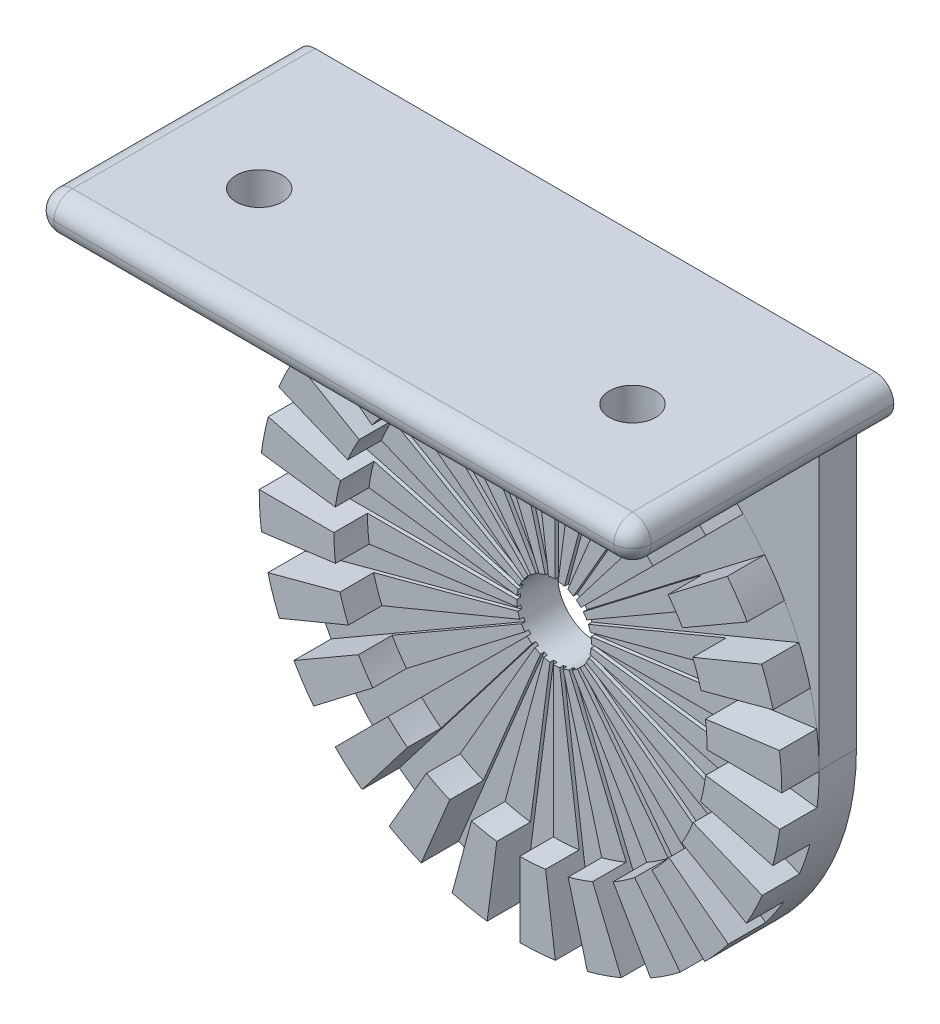
from build123d import *

# Parameters (mm, degrees)
BOSS_EXTRUDE2_DEPTH     = 5
BOSS_EXTRUDE2_2_DEPTH   = 5
BOSS_EXTRUDE2_3_DEPTH   = 5
BOSS_EXTRUDE2_4_DEPTH   = 5
BOSS_EXTRUDE2_5_DEPTH   = 5
BOSS_EXTRUDE2_6_DEPTH   = 5
BOSS_EXTRUDE2_7_DEPTH   = 5
BOSS_EXTRUDE2_8_DEPTH   = 5
BOSS_EXTRUDE2_9_DEPTH   = 5
BOSS_EXTRUDE2_10_DEPTH  = 5
BOSS_EXTRUDE2_11_DEPTH  = 5
BOSS_EXTRUDE2_12_DEPTH  = 5
BOSS_EXTRUDE2_13_DEPTH  = 5
BOSS_EXTRUDE2_14_DEPTH  = 5
BOSS_EXTRUDE2_15_DEPTH  = 5
BOSS_EXTRUDE2_16_DEPTH  = 5
BOSS_EXTRUDE2_17_DEPTH  = 5
BOSS_EXTRUDE2_18_DEPTH  = 5
BOSS_EXTRUDE2_19_DEPTH  = 5
BOSS_EXTRUDE2_20_DEPTH  = 5
BOSS_EXTRUDE2_21_DEPTH  = 5
BOSS_EXTRUDE2_22_DEPTH  = 5
BOSS_EXTRUDE2_23_DEPTH  = 5
BOSS_EXTRUDE2_24_DEPTH  = 5
BOSS_EXTRUDE3_DEPTH     = 10
CUT_EXTRUDE1_DEPTH      = 51.497524692
CUT_EXTRUDE1_DEPTH_BACK = 51.497524692
SKETCH3_R               = 5
CUT_EXTRUDE6_START      = 5.5
SKETCH9_R               = 25
CUT_EXTRUDE6_DEPTH      = 5.5
SKETCH4_W               = 80
SKETCH4_H               = 35
BOSS_EXTRUDE4_DEPTH     = 5
SKETCH6_R               = 3.1
CUT_EXTRUDE2_DEPTH      = 97.046863562
BOSS_EXTRUDE5_DEPTH     = 5
FILLET2_R               = 2.5


# Read off the part's stored shape, not the designer's step: Boss-Extrude3
with BuildPart() as part:
    # Sketch1 → Boss-Extrude2 (new body)
    with BuildSketch(Plane.XY):
        with BuildLine():
            Line((-34.999857143, 0.1), (-1.525705169, 0.1))
            Line((-1.525705169, 0.1), (-34.713481132, 4.469253595))
            ThreePointArc((-34.713481132, 4.469253595), (-34.925062313, 2.289109523), (-34.999857143, 0.1))
        make_face()
    extrude(amount=BOSS_EXTRUDE2_DEPTH)



with BuildPart() as body_2:
    # Sketch1 → Boss-Extrude2 2 (new body)
    with BuildSketch(Plane.XY):
        with BuildLine():
            ThreePointArc((-32.373919998, 13.30147751), (-33.142554532, 11.250381286), (-33.781384026, 9.155222187))
            Line((-33.781384026, 9.155222187), (-1.447836121, 0.491474138))
            Line((-1.447836121, 0.491474138), (-32.373919998, 13.30147751))
        make_face()
    extrude(amount=BOSS_EXTRUDE2_2_DEPTH)


with BuildPart() as body_3:
    # Sketch1 → Boss-Extrude2 3 (new body)
    with BuildSketch(Plane.XY):
        with BuildLine():
            ThreePointArc((-27.828129717, 21.227227715), (-29.101436431, 19.444958156), (-30.260765414, 17.586531112))
            Line((-30.260765414, 17.586531112), (-1.271299435, 0.849455125))
            Line((-1.271299435, 0.849455125), (-27.828129717, 21.227227715))
        make_face()
    extrude(amount=BOSS_EXTRUDE2_3_DEPTH)


with BuildPart() as body_4:
    # Sketch1 → Boss-Extrude2 4 (new body)
    with BuildSketch(Plane.XY):
        with BuildLine():
            ThreePointArc((-21.385898383, 27.706377431), (-23.077103529, 26.314393262), (-24.677925648, 24.819347004))
            Line((-24.677925648, 24.819347004), (-1.008125793, 1.149547149))
            Line((-1.008125793, 1.149547149), (-21.385898383, 27.706377431))
        make_face()
    extrude(amount=BOSS_EXTRUDE2_4_DEPTH)


with BuildPart() as body_5:
    # Sketch1 → Boss-Extrude2 5 (new body)
    with BuildSketch(Plane.XY):
        with BuildLine():
            ThreePointArc((-13.486253417, 32.297383312), (-15.480104158, 31.390545954), (-17.413326031, 30.360765414))
            Line((-17.413326031, 30.360765414), (-0.676250044, 1.371299435))
            Line((-0.676250044, 1.371299435), (-13.486253417, 32.297383312))
        make_face()
    extrude(amount=BOSS_EXTRUDE2_5_DEPTH)


with BuildPart() as body_6:
    # Sketch1 → Boss-Extrude2 6 (new body)
    with BuildSketch(Plane.XY):
        with BuildLine():
            ThreePointArc((-4.667542567, 34.687375894), (-6.828161271, 34.327484814), (-8.962037022, 33.833147835))
            Line((-8.962037022, 33.833147835), (-0.298288972, 1.49959993))
            Line((-0.298288972, 1.49959993), (-4.667542567, 34.687375894))
        make_face()
    extrude(amount=BOSS_EXTRUDE2_6_DEPTH)


with BuildPart() as body_7:
    # Sketch1 → Boss-Extrude2 7 (new body)
    with BuildSketch(Plane.XY):
        with BuildLine():
            ThreePointArc((4.469253595, 34.713481132), (2.289109523, 34.925062313), (0.1, 34.999857143))
            Line((0.1, 34.999857143), (0.1, 1.525705169))
            Line((0.1, 1.525705169), (4.469253595, 34.713481132))
        make_face()
    extrude(amount=BOSS_EXTRUDE2_7_DEPTH)


with BuildPart() as body_8:
    # Sketch1 → Boss-Extrude2 8 (new body)
    with BuildSketch(Plane.XY):
        with BuildLine():
            ThreePointArc((13.30147751, 32.373919998), (11.250381286, 33.142554532), (9.155222187, 33.781384026))
            Line((9.155222187, 33.781384026), (0.491474138, 1.447836121))
            Line((0.491474138, 1.447836121), (13.30147751, 32.373919998))
        make_face()
    extrude(amount=BOSS_EXTRUDE2_8_DEPTH)


with BuildPart() as body_9:
    # Sketch1 → Boss-Extrude2 9 (new body)
    with BuildSketch(Plane.XY):
        with BuildLine():
            ThreePointArc((21.227227715, 27.828129717), (19.444958156, 29.101436431), (17.586531112, 30.260765414))
            Line((17.586531112, 30.260765414), (0.849455125, 1.271299435))
            Line((0.849455125, 1.271299435), (21.227227715, 27.828129717))
        make_face()
    extrude(amount=BOSS_EXTRUDE2_9_DEPTH)


with BuildPart() as body_10:
    # Sketch1 → Boss-Extrude2 10 (new body)
    with BuildSketch(Plane.XY):
        with BuildLine():
            ThreePointArc((27.706377431, 21.385898383), (26.314393262, 23.077103529), (24.819347004, 24.677925648))
            Line((24.819347004, 24.677925648), (1.149547149, 1.008125793))
            Line((1.149547149, 1.008125793), (27.706377431, 21.385898383))
        make_face()
    extrude(amount=BOSS_EXTRUDE2_10_DEPTH)


with BuildPart() as body_11:
    # Sketch1 → Boss-Extrude2 11 (new body)
    with BuildSketch(Plane.XY):
        with BuildLine():
            ThreePointArc((32.297383312, 13.486253417), (31.390545954, 15.480104158), (30.360765414, 17.413326031))
            Line((30.360765414, 17.413326031), (1.371299435, 0.676250044))
            Line((1.371299435, 0.676250044), (32.297383312, 13.486253417))
        make_face()
    extrude(amount=BOSS_EXTRUDE2_11_DEPTH)


with BuildPart() as body_12:
    # Sketch1 → Boss-Extrude2 12 (new body)
    with BuildSketch(Plane.XY):
        with BuildLine():
            ThreePointArc((34.687375894, 4.667542567), (34.327484814, 6.828161271), (33.833147835, 8.962037022))
            Line((33.833147835, 8.962037022), (1.49959993, 0.298288972))
            Line((1.49959993, 0.298288972), (34.687375894, 4.667542567))
        make_face()
    extrude(amount=BOSS_EXTRUDE2_12_DEPTH)


with BuildPart() as body_13:
    # Sketch1 → Boss-Extrude2 13 (new body)
    with BuildSketch(Plane.XY):
        with BuildLine():
            Line((1.525705169, -0.1), (34.713481132, -4.469253595))
            ThreePointArc((34.713481132, -4.469253595), (34.925062313, -2.289109523), (34.999857143, -0.1))
            Line((34.999857143, -0.1), (1.525705169, -0.1))
        make_face()
    extrude(amount=BOSS_EXTRUDE2_13_DEPTH)


with BuildPart() as body_14:
    # Sketch1 → Boss-Extrude2 14 (new body)
    with BuildSketch(Plane.XY):
        with BuildLine():
            Line((1.447836121, -0.491474138), (32.373919998, -13.30147751))
            ThreePointArc((32.373919998, -13.30147751), (33.142554532, -11.250381286), (33.781384026, -9.155222187))
            Line((33.781384026, -9.155222187), (1.447836121, -0.491474138))
        make_face()
    extrude(amount=BOSS_EXTRUDE2_14_DEPTH)


with BuildPart() as body_15:
    # Sketch1 → Boss-Extrude2 15 (new body)
    with BuildSketch(Plane.XY):
        with BuildLine():
            Line((1.271299435, -0.849455125), (27.828129717, -21.227227715))
            ThreePointArc((27.828129717, -21.227227715), (29.101436431, -19.444958156), (30.260765414, -17.586531112))
            Line((30.260765414, -17.586531112), (1.271299435, -0.849455125))
        make_face()
    extrude(amount=BOSS_EXTRUDE2_15_DEPTH)


with BuildPart() as body_16:
    # Sketch1 → Boss-Extrude2 16 (new body)
    with BuildSketch(Plane.XY):
        with BuildLine():
            Line((1.008125793, -1.149547149), (21.385898383, -27.706377431))
            ThreePointArc((21.385898383, -27.706377431), (23.077103529, -26.314393262), (24.677925648, -24.819347004))
            Line((24.677925648, -24.819347004), (1.008125793, -1.149547149))
        make_face()
    extrude(amount=BOSS_EXTRUDE2_16_DEPTH)


with BuildPart() as body_17:
    # Sketch1 → Boss-Extrude2 17 (new body)
    with BuildSketch(Plane.XY):
        with BuildLine():
            Line((0.676250044, -1.371299435), (13.486253417, -32.297383312))
            ThreePointArc((13.486253417, -32.297383312), (15.480104158, -31.390545954), (17.413326031, -30.360765414))
            Line((17.413326031, -30.360765414), (0.676250044, -1.371299435))
        make_face()
    extrude(amount=BOSS_EXTRUDE2_17_DEPTH)


with BuildPart() as body_18:
    # Sketch1 → Boss-Extrude2 18 (new body)
    with BuildSketch(Plane.XY):
        with BuildLine():
            Line((0.298288972, -1.49959993), (4.667542567, -34.687375894))
            ThreePointArc((4.667542567, -34.687375894), (6.828161271, -34.327484814), (8.962037022, -33.833147835))
            Line((8.962037022, -33.833147835), (0.298288972, -1.49959993))
        make_face()
    extrude(amount=BOSS_EXTRUDE2_18_DEPTH)


with BuildPart() as body_19:
    # Sketch1 → Boss-Extrude2 19 (new body)
    with BuildSketch(Plane.XY):
        with BuildLine():
            Line((-0.1, -1.525705169), (-4.469253595, -34.713481132))
            ThreePointArc((-4.469253595, -34.713481132), (-2.289109523, -34.925062313), (-0.1, -34.999857143))
            Line((-0.1, -34.999857143), (-0.1, -1.525705169))
        make_face()
    extrude(amount=BOSS_EXTRUDE2_19_DEPTH)


with BuildPart() as body_20:
    # Sketch1 → Boss-Extrude2 20 (new body)
    with BuildSketch(Plane.XY):
        with BuildLine():
            Line((-0.491474138, -1.447836121), (-13.30147751, -32.373919998))
            ThreePointArc((-13.30147751, -32.373919998), (-11.250381286, -33.142554532), (-9.155222187, -33.781384026))
            Line((-9.155222187, -33.781384026), (-0.491474138, -1.447836121))
        make_face()
    extrude(amount=BOSS_EXTRUDE2_20_DEPTH)


with BuildPart() as body_21:
    # Sketch1 → Boss-Extrude2 21 (new body)
    with BuildSketch(Plane.XY):
        with BuildLine():
            Line((-0.849455125, -1.271299435), (-21.227227715, -27.828129717))
            ThreePointArc((-21.227227715, -27.828129717), (-19.444958156, -29.101436431), (-17.586531112, -30.260765414))
            Line((-17.586531112, -30.260765414), (-0.849455125, -1.271299435))
        make_face()
    extrude(amount=BOSS_EXTRUDE2_21_DEPTH)


with BuildPart() as body_22:
    # Sketch1 → Boss-Extrude2 22 (new body)
    with BuildSketch(Plane.XY):
        with BuildLine():
            Line((-1.149547149, -1.008125793), (-27.706377431, -21.385898383))
            ThreePointArc((-27.706377431, -21.385898383), (-26.314393262, -23.077103529), (-24.819347004, -24.677925648))
            Line((-24.819347004, -24.677925648), (-1.149547149, -1.008125793))
        make_face()
    extrude(amount=BOSS_EXTRUDE2_22_DEPTH)


with BuildPart() as body_23:
    # Sketch1 → Boss-Extrude2 23 (new body)
    with BuildSketch(Plane.XY):
        with BuildLine():
            Line((-1.49959993, -0.298288972), (-34.687375894, -4.667542567))
            ThreePointArc((-34.687375894, -4.667542567), (-34.327484814, -6.828161271), (-33.833147835, -8.962037022))
            Line((-33.833147835, -8.962037022), (-1.49959993, -0.298288972))
        make_face()
    extrude(amount=BOSS_EXTRUDE2_23_DEPTH)


with BuildPart() as body_24:
    # Sketch1 → Boss-Extrude2 24 (new body)
    with BuildSketch(Plane.XY):
        with BuildLine():
            Line((-1.371299435, -0.676250044), (-32.297383312, -13.486253417))
            ThreePointArc((-32.297383312, -13.486253417), (-31.390545954, -15.480104158), (-30.360765414, -17.413326031))
            Line((-30.360765414, -17.413326031), (-1.371299435, -0.676250044))
        make_face()
    extrude(amount=BOSS_EXTRUDE2_24_DEPTH)


with BuildPart() as part_1:
    add(part.part)

    add(body_2.part)  # Boss-Extrude3 merges body 2

    add(body_3.part)  # Boss-Extrude3 merges body 3

    add(body_4.part)  # Boss-Extrude3 merges body 4

    add(body_5.part)  # Boss-Extrude3 merges body 5

    add(body_6.part)  # Boss-Extrude3 merges body 6

    add(body_7.part)  # Boss-Extrude3 merges body 7

    add(body_8.part)  # Boss-Extrude3 merges body 8

    add(body_9.part)  # Boss-Extrude3 merges body 9

    add(body_10.part)  # Boss-Extrude3 merges body 10

    add(body_11.part)  # Boss-Extrude3 merges body 11

    add(body_12.part)  # Boss-Extrude3 merges body 12

    add(body_13.part)  # Boss-Extrude3 merges body 13

    add(body_14.part)  # Boss-Extrude3 merges body 14

    add(body_15.part)  # Boss-Extrude3 merges body 15

    add(body_16.part)  # Boss-Extrude3 merges body 16

    add(body_17.part)  # Boss-Extrude3 merges body 17

    add(body_18.part)  # Boss-Extrude3 merges body 18

    add(body_19.part)  # Boss-Extrude3 merges body 19

    add(body_20.part)  # Boss-Extrude3 merges body 20

    add(body_21.part)  # Boss-Extrude3 merges body 21

    add(body_22.part)  # Boss-Extrude3 merges body 22

    add(body_23.part)  # Boss-Extrude3 merges body 23

    add(body_24.part)  # Boss-Extrude3 merges body 24
    # Boss-Extrude3 outline → Boss-Extrude3 (add)
    with BuildSketch(Plane.XY):
        with BuildLine():
            ThreePointArc((34.999857143, -0.1), (34.925062313, 2.289109523), (34.687375894, 4.667542567))
            Line((34.687375894, 4.667542567), (1.49959993, 0.298288972))
            Line((1.49959993, 0.298288972), (33.833147835, 8.962037022))
            ThreePointArc((33.833147835, 8.962037022), (33.142554532, 11.250381286), (32.297383312, 13.486253417))
            Line((32.297383312, 13.486253417), (1.371299435, 0.676250044))
            Line((1.371299435, 0.676250044), (30.360765414, 17.413326031))
            ThreePointArc((30.360765414, 17.413326031), (29.101436431, 19.444958156), (27.706377431, 21.385898383))
            Line((27.706377431, 21.385898383), (1.149547149, 1.008125793))
            Line((1.149547149, 1.008125793), (24.819347004, 24.677925648))
            ThreePointArc((24.819347004, 24.677925648), (23.077103528, 26.314393262), (21.227227715, 27.828129717))
            Line((21.227227715, 27.828129717), (0.849455125, 1.271299435))
            Line((0.849455125, 1.271299435), (17.586531112, 30.260765414))
            ThreePointArc((17.586531112, 30.260765414), (15.480104158, 31.390545954), (13.30147751, 32.373919998))
            Line((13.30147751, 32.373919998), (0.491474138, 1.447836121))
            Line((0.491474138, 1.447836121), (9.155222187, 33.781384026))
            ThreePointArc((9.155222187, 33.781384026), (6.828161271, 34.327484814), (4.469253595, 34.713481132))
            Line((4.469253595, 34.713481132), (0.1, 1.525705169))
            Line((0.1, 1.525705169), (0.1, 34.999857143))
            ThreePointArc((0.1, 34.999857143), (-2.289109523, 34.925062313), (-4.667542567, 34.687375894))
            Line((-4.667542567, 34.687375894), (-0.298288972, 1.49959993))
            Line((-0.298288972, 1.49959993), (-8.962037022, 33.833147835))
            ThreePointArc((-8.962037022, 33.833147835), (-11.250381286, 33.142554532), (-13.486253417, 32.297383312))
            Line((-13.486253417, 32.297383312), (-0.676250044, 1.371299435))
            Line((-0.676250044, 1.371299435), (-17.413326031, 30.360765414))
            ThreePointArc((-17.413326031, 30.360765414), (-19.444958156, 29.101436431), (-21.385898383, 27.706377431))
            Line((-21.385898383, 27.706377431), (-1.008125793, 1.149547149))
            Line((-1.008125793, 1.149547149), (-24.677925648, 24.819347004))
            ThreePointArc((-24.677925648, 24.819347004), (-26.314393262, 23.077103528), (-27.828129717, 21.227227715))
            Line((-27.828129717, 21.227227715), (-1.271299435, 0.849455125))
            Line((-1.271299435, 0.849455125), (-30.260765414, 17.586531112))
            ThreePointArc((-30.260765414, 17.586531112), (-31.390545954, 15.480104158), (-32.373919998, 13.30147751))
            Line((-32.373919998, 13.30147751), (-1.447836121, 0.491474138))
            Line((-1.447836121, 0.491474138), (-33.781384026, 9.155222187))
            ThreePointArc((-33.781384026, 9.155222187), (-34.327484814, 6.828161271), (-34.713481132, 4.469253595))
            Line((-34.713481132, 4.469253595), (-1.525705169, 0.1))
            Line((-1.525705169, 0.1), (-34.999857143, 0.1))
            ThreePointArc((-34.999857143, 0.1), (-34.925062313, -2.289109523), (-34.687375894, -4.667542567))
            Line((-34.687375894, -4.667542567), (-1.49959993, -0.298288972))
            Line((-1.49959993, -0.298288972), (-33.833147835, -8.962037022))
            ThreePointArc((-33.833147835, -8.962037022), (-33.142554532, -11.250381286), (-32.297383312, -13.486253417))
            Line((-32.297383312, -13.486253417), (-1.371299435, -0.676250044))
            Line((-1.371299435, -0.676250044), (-30.360765414, -17.413326031))
            ThreePointArc((-30.360765414, -17.413326031), (-29.101436431, -19.444958156), (-27.706377431, -21.385898383))
            Line((-27.706377431, -21.385898383), (-1.149547149, -1.008125793))
            Line((-1.149547149, -1.008125793), (-24.819347004, -24.677925648))
            ThreePointArc((-24.819347004, -24.677925648), (-23.077103528, -26.314393262), (-21.227227715, -27.828129717))
            Line((-21.227227715, -27.828129717), (-0.849455125, -1.271299435))
            Line((-0.849455125, -1.271299435), (-17.586531112, -30.260765414))
            ThreePointArc((-17.586531112, -30.260765414), (-15.480104158, -31.390545954), (-13.30147751, -32.373919998))
            Line((-13.30147751, -32.373919998), (-0.491474138, -1.447836121))
            Line((-0.491474138, -1.447836121), (-9.155222187, -33.781384026))
            ThreePointArc((-9.155222187, -33.781384026), (-6.828161271, -34.327484814), (-4.469253595, -34.713481132))
            Line((-4.469253595, -34.713481132), (-0.1, -1.525705169))
            Line((-0.1, -1.525705169), (-0.1, -34.999857143))
            ThreePointArc((-0.1, -34.999857143), (2.289109523, -34.925062313), (4.667542567, -34.687375894))
            Line((4.667542567, -34.687375894), (0.298288972, -1.49959993))
            Line((0.298288972, -1.49959993), (8.962037022, -33.833147835))
            ThreePointArc((8.962037022, -33.833147835), (11.250381286, -33.142554532), (13.486253417, -32.297383312))
            Line((13.486253417, -32.297383312), (0.676250044, -1.371299435))
            Line((0.676250044, -1.371299435), (17.413326031, -30.360765414))
            ThreePointArc((17.413326031, -30.360765414), (19.444958156, -29.101436431), (21.385898383, -27.706377431))
            Line((21.385898383, -27.706377431), (1.008125793, -1.149547149))
            Line((1.008125793, -1.149547149), (24.677925648, -24.819347004))
            ThreePointArc((24.677925648, -24.819347004), (26.314393262, -23.077103528), (27.828129717, -21.227227715))
            Line((27.828129717, -21.227227715), (1.271299435, -0.849455125))
            Line((1.271299435, -0.849455125), (30.260765414, -17.586531112))
            ThreePointArc((30.260765414, -17.586531112), (31.390545954, -15.480104158), (32.373919998, -13.30147751))
            Line((32.373919998, -13.30147751), (1.447836121, -0.491474138))
            Line((1.447836121, -0.491474138), (33.781384026, -9.155222187))
            ThreePointArc((33.781384026, -9.155222187), (34.327484814, -6.828161271), (34.713481132, -4.469253595))
            Line((34.713481132, -4.469253595), (1.525705169, -0.1))
            Line((1.525705169, -0.1), (34.999857143, -0.1))
        make_face()
    extrude(amount=BOSS_EXTRUDE3_DEPTH)

    # Sketch3 → Cut-Extrude1 (cut, two sides: drawn at the far end of the back side and taken through both)
    with BuildSketch(Plane.XY.offset(-CUT_EXTRUDE1_DEPTH_BACK)):
        Circle(SKETCH3_R)
    extrude(amount=CUT_EXTRUDE1_DEPTH + CUT_EXTRUDE1_DEPTH_BACK, mode=Mode.SUBTRACT)

    # Sketch9 → Cut-Extrude6 (cut)
    with BuildSketch(Plane.XY.offset(CUT_EXTRUDE6_START)):
        Circle(SKETCH9_R)
    extrude(amount=CUT_EXTRUDE6_DEPTH, mode=Mode.SUBTRACT)


with BuildPart() as body_2_2:
    # Sketch4 → Boss-Extrude4 (new body)
    with BuildSketch(Plane(origin=(0, 40, 0), x_dir=(1, 0, 0), z_dir=(0, 1, 0))):
        with Locations((0, -17.5)):
            Rectangle(SKETCH4_W, SKETCH4_H)
    extrude(amount=BOSS_EXTRUDE4_DEPTH)

    # Sketch6 → Cut-Extrude2 (cut, through all)
    with BuildSketch(Plane(origin=(0, 45, 0), x_dir=(1, 0, 0), z_dir=(0, 1, 0))):
        with Locations(Location((-25, -20, 0), (0, 0, 90))):
            Circle(SKETCH6_R)
        with Locations(Location((25, -20, 0), (0, 0, 270))):
            Circle(SKETCH6_R)
    extrude(amount=-CUT_EXTRUDE2_DEPTH, mode=Mode.SUBTRACT)

    # Sketch10 → Boss-Extrude5 (add)
    with BuildSketch(Plane.XY):
        with BuildLine():
            Line((-35, 0), (-35, 40))
            Line((-35, 40), (35, 40))
            Line((35, 40), (35, 0))
            ThreePointArc((35, 0), (0, 35), (-35, 0))
        make_face()
    extrude(amount=BOSS_EXTRUDE5_DEPTH)

    # Fillet2
    fillet2_edges = [body_2_2.edges().sort_by_distance(p)[0] for p in [
        (40, 45, 17.5),
        (35, 40, 2.5),
        (-35, 40, 2.5),
        (0, 45, 35),
        (40, 40, 17.5),
        (-40, 40, 17.5),
        (0, 40, 35),
        (40, 42.5, 35),
        (-40, 42.5, 35),
        (-40, 45, 17.5),
    ]]
    fillet(fillet2_edges, radius=FILLET2_R - 0.0001)  # a hair under: the kernel refuses the full size


solid = Compound([part_1.part, body_2_2.part])
